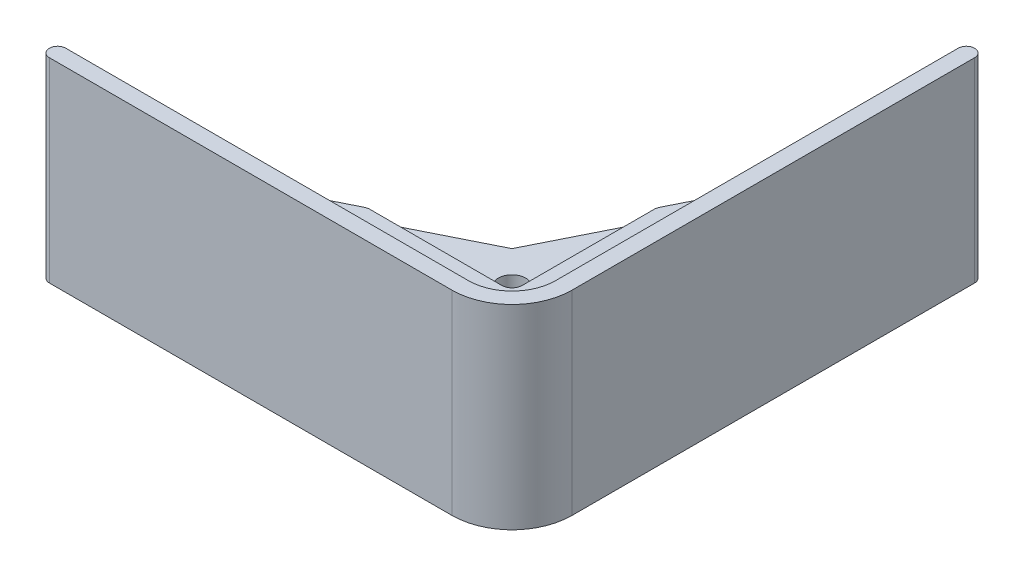
from build123d import *

# Parameters (mm, degrees)
SKETCH1_R           = 4.28625
BOSS_EXTRUDE1_DEPTH = 50.8
FILLET2_R           = 2.54
SKETCH7_W           = 44.675933609
SKETCH7_H           = 44.675933609
CUT_EXTRUDE3_DEPTH  = 3.429
FILLET9_R           = 3.175
BOSS_EXTRUDE2_DEPTH = 30.1625
CUT_EXTRUDE4_START  = -4.7625
CUT_EXTRUDE4_DEPTH  = 4.7625


with BuildPart() as part:
    # Sketch1 → Boss-Extrude1 (new body)
    with BuildSketch(Plane(origin=(0, 0, 0), x_dir=(1, 0, 0), z_dir=(0, 1, 0))):
        with BuildLine():
            Line((13.462, 57.17106993), (-10.037787665, 10.037787665))
            Line((-10.037787665, 10.037787665), (-57.17106993, -13.462))
            Line((-57.17106993, -13.462), (-127, -13.462))
            Line((-127, -13.462), (-127, -18.542))
            Line((-127, -18.542), (0, -18.542))
            ThreePointArc((0, -18.542), (13.111173937, -13.111173937), (18.542, 0))
            Line((18.542, 0), (18.542, 127))
            Line((18.542, 127), (13.462, 127))
            Line((13.462, 127), (13.462, 57.17106993))
        make_face()
        with Locations(Location((0, 0, 0), (0, 0, 270))):
            Circle(SKETCH1_R, mode=Mode.SUBTRACT)
    extrude(amount=BOSS_EXTRUDE1_DEPTH)

    # Fillet2
    fillet2_edges = [part.edges().sort_by_distance(p)[0] for p in [
        (13.462, 25.4, -127),
        (18.542, 25.4, -127),
        (-127, 25.4, 13.462),
        (-127, 25.4, 18.542),
    ]]
    fillet(fillet2_edges, radius=FILLET2_R - 0.0001)  # a hair under: the kernel refuses the full size

    # Sketch7 → Cut-Extrude3 (cut)
    with BuildSketch(Plane(origin=(0, 50.8, 0), x_dir=(1, 0, 0), z_dir=(0, 1, 0))):
        with Locations((-17.511966805, 17.511966805)):
            Rectangle(SKETCH7_W, SKETCH7_H)
    extrude(amount=-CUT_EXTRUDE3_DEPTH, mode=Mode.SUBTRACT)

    # Fillet9
    fillet9_edges = [part.edges().sort_by_distance(p)[0] for p in [
        (4.826, 49.0855, -39.849933609),
        (4.826, 49.0855, 4.826),
        (-39.849933609, 49.0855, 4.826),
    ]]
    fillet(fillet9_edges, radius=FILLET9_R)

    # Sketch8 → Boss-Extrude2 (add, symmetric)
    with BuildSketch(Plane(origin=(0, 25.4, 0), x_dir=(1, 0, 0), z_dir=(0, 1, 0))):
        with BuildLine():
            Line((0, -13.462), (-124.46, -13.462))
            ThreePointArc((-124.46, -13.462), (-126.256051224, -14.205948776), (-127, -16.002))
            ThreePointArc((-127, -16.002), (-126.256051224, -17.798051224), (-124.46, -18.542))
            Line((-124.46, -18.542), (0, -18.542))
            ThreePointArc((0, -18.542), (13.111173937, -13.111173937), (18.542, 0))
            Line((18.542, 0), (18.542, 124.46))
            ThreePointArc((18.542, 124.46), (17.798051224, 126.256051224), (16.002, 127))
            ThreePointArc((16.002, 127), (14.205948776, 126.256051224), (13.462, 124.46))
            Line((13.462, 124.46), (13.462, 0))
            ThreePointArc((13.462, 0), (9.519071488, -9.519071488), (0, -13.462))
        make_face()
    extrude(amount=BOSS_EXTRUDE2_DEPTH, both=True)

    # Sketch9 → Cut-Extrude4 (cut)
    with BuildSketch(Plane.XZ.offset(4.7625).offset(CUT_EXTRUDE4_START)):
        with BuildLine():
            Line((7.112, 13.462), (0, 13.462))
            ThreePointArc((0, 13.462), (9.519071488, 9.519071488), (13.462, 0))
            Line((13.462, 0), (13.462, 7.112))
            ThreePointArc((13.462, 7.112), (11.602128061, 11.602128061), (7.112, 13.462))
        make_face()
    extrude(amount=CUT_EXTRUDE4_DEPTH, mode=Mode.SUBTRACT)


solid = part.part
